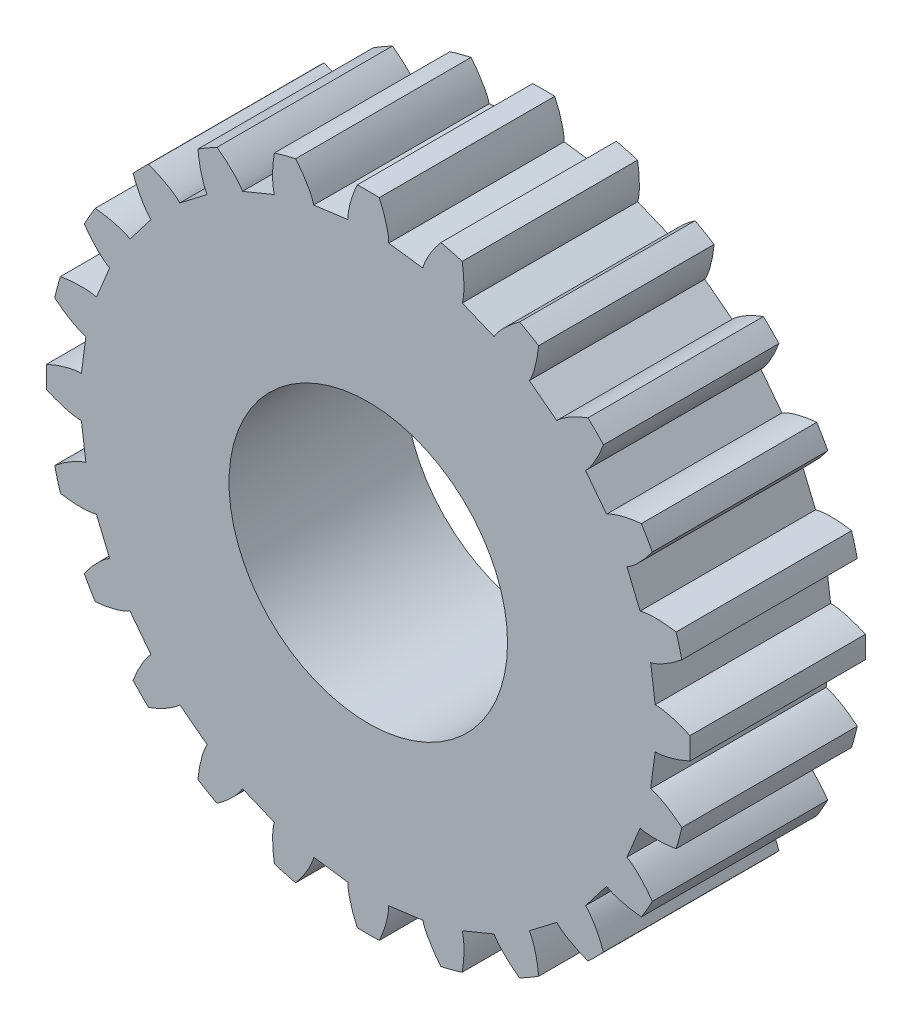
from build123d import *

# Parameters (mm, degrees)
SKETCH1_R               = 11.006666667
BOSS_EXTRUDE1_DEPTH     = 6
CUT_EXTRUDE2_DEPTH      = 7
CIRPATTERN1_COUNT       = 24
CUT_EXTRUDE4_DEPTH      = 8
CUT_EXTRUDE4_DEPTH_BACK = 8
SKETCH3_R               = 4.7625


with BuildPart() as part:
    # Sketch1 → Boss-Extrude1 (new body)
    with BuildSketch(Plane.XY):
        Circle(SKETCH1_R)
    extrude(amount=BOSS_EXTRUDE1_DEPTH)

    # Sketch2 → Cut-Extrude2 (cut, symmetric)
    with BuildSketch(Plane.XY):
        with BuildLine():
            add(Edge.make_bspline(
                [(9.811601549, 0.69774427), (9.816735612, 0.698054605), (9.826462672, 0.698325401), (9.842356124, 0.698425449), (9.873760862, 0.697746399), (9.909309677, 0.695780818), (9.949509524, 0.692377795), (9.992756609, 0.687536131), (10.029755148, 0.682661042), (10.066680285, 0.677112981), (10.10347658, 0.670968308), (10.148060104, 0.662794525), (10.201533151, 0.651977658), (10.264043807, 0.637853698), (10.334942782, 0.620087135), (10.407190915, 0.600109977), (10.478270187, 0.578915654), (10.550059068, 0.55573386), (10.619498527, 0.532051843), (10.691583262, 0.505641941), (10.758100398, 0.480343183), (10.832564391, 0.449994146), (10.89264098, 0.424916906), (10.954641836, 0.397339706), (10.984809153, 0.3836709), (11.000222617, 0.376581305)],
                knots=[0, 0, 0, 0, 0, 0.015083688, 0.02853182, 0.04661014, 0.092110526, 0.119476176, 0.146842496, 0.174208854, 0.201574956, 0.228941013, 0.256307345, 0.307035032, 0.361767352, 0.416499661, 0.471231937, 0.525964282, 0.580696616, 0.635428982, 0.690161387, 0.744893688, 0.799626082, 0.854358407, 0.909090914, 0.909090914, 0.909090914, 0.909090914, 0.909090914], degree=4))
            Line((11.000222617, 0.376581305), (59.96487193, 2.052835701))
            add(Edge.make_bspline(
                [(59.96487193, 2.052835701), (59.960934107, 2.167862468), (59.952417262, 2.391869008), (59.929284497, 2.956124274), (59.904333862, 3.387502943), (59.867724952, 4.011113833), (59.829984594, 4.518610932), (59.784812444, 5.095603669), (59.735960228, 5.630019941), (59.681269294, 6.189209553), (59.621877689, 6.733045979), (59.557395976, 7.284513803), (59.487586169, 7.831689295), (59.413397826, 8.378288341), (59.332952003, 8.92765445), (59.249564663, 9.468331778), (59.157663128, 10.022622521), (59.066533635, 10.551472884), (58.960829872, 11.120496483), (58.865934345, 11.620468961), (58.739893461, 12.232305909), (58.652344908, 12.655443405), (58.528649435, 13.20645934), (58.478898916, 13.425037363), (58.452931443, 13.537163872)],
                knots=[0.083333333, 0.083333333, 0.083333333, 0.083333333, 0.083333333, 0.123015873, 0.162698413, 0.202380952, 0.242063492, 0.281746032, 0.321428571, 0.361111111, 0.400793651, 0.44047619, 0.48015873, 0.51984127, 0.55952381, 0.599206349, 0.638888889, 0.678571429, 0.718253968, 0.757936508, 0.797619048, 0.837301587, 0.876984127, 0.916666667, 0.916666667, 0.916666667, 0.916666667, 0.916666667], degree=4))
            Line((58.452931443, 13.537163872), (10.722865535, 2.483317506))
            add(Edge.make_bspline(
                [(9.657868839, 1.865460134), (9.662908284, 1.866489165), (9.67237399, 1.868745145), (9.68775178, 1.872762035), (9.717910676, 1.881546091), (9.751739465, 1.892645407), (9.789688768, 1.90633696), (9.830209129, 1.922206818), (9.864685208, 1.936491719), (9.898916207, 1.951407663), (9.93286834, 1.966866543), (9.973817187, 1.986300876), (10.022668573, 2.01058901), (10.07939368, 2.040410657), (10.143278506, 2.075921844), (10.207894375, 2.113917489), (10.271066185, 2.152786303), (10.33440903, 2.193758526), (10.39535304, 2.234605852), (10.45814616, 2.278772761), (10.51584898, 2.320425386), (10.579920766, 2.369013005), (10.631459827, 2.408784723), (10.68421055, 2.451469255), (10.709812194, 2.472480184), (10.722865535, 2.483317506)],
                knots=[0, 0, 0, 0, 0, 0.015083688, 0.02853182, 0.04661014, 0.092110526, 0.119476176, 0.146842496, 0.174208854, 0.201574956, 0.228941013, 0.256307345, 0.307035032, 0.361767352, 0.416499661, 0.471231937, 0.525964282, 0.580696616, 0.635428982, 0.690161387, 0.744893688, 0.799626082, 0.854358407, 0.909090914, 0.909090914, 0.909090914, 0.909090914, 0.909090914], degree=4))
            Line((9.657868839, 1.865460134), (9.811601549, 0.69774427))
        make_face()
    cut_extrude2 = extrude(amount=CUT_EXTRUDE2_DEPTH, both=True, mode=Mode.SUBTRACT)

    # CirPattern1: Cut-Extrude2 ×24 about axis
    cirpattern1_axis = Axis((0, 0, -0.3), (0, 0, 1))
    for i in range(1, CIRPATTERN1_COUNT):
        add(cut_extrude2.rotate(cirpattern1_axis, i * 360 / CIRPATTERN1_COUNT), mode=Mode.SUBTRACT)

    # Sketch3 → Cut-Extrude4 (cut, two sides: drawn at the far end of the back side and taken through both)
    with BuildSketch(Plane.XY.offset(-CUT_EXTRUDE4_DEPTH_BACK)):
        Circle(SKETCH3_R)
    extrude(amount=CUT_EXTRUDE4_DEPTH + CUT_EXTRUDE4_DEPTH_BACK, mode=Mode.SUBTRACT)


solid = part.part
